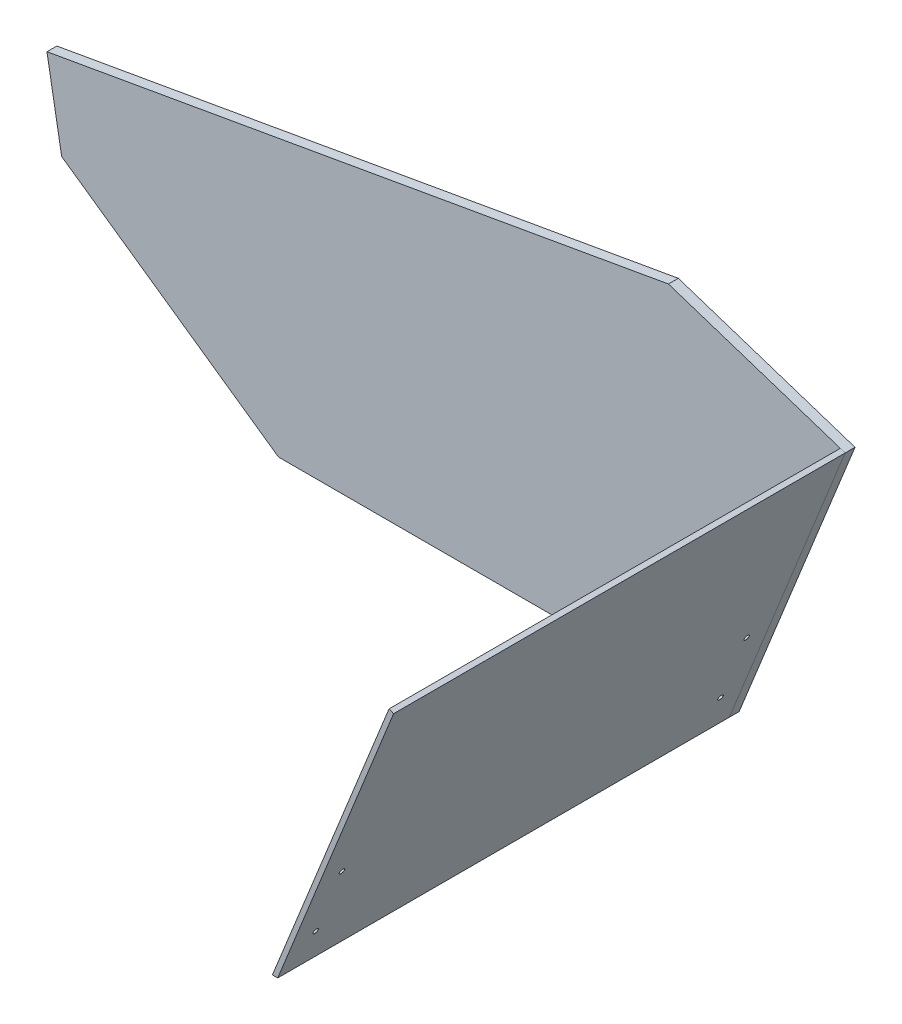
from build123d import *

# Parameters (mm, degrees)
BOSS_EXTRUDE1_DEPTH           = 290
BOSS_EXTRUDE2_DEPTH           = 6.35
M3_CLEARANCE_HOLE1_AT_2_COUNT = 2
M3_CLEARANCE_HOLE1_AT_2_PITCH = 45
M3_CLEARANCE_HOLE1_AT_3_COUNT = 2
M3_CLEARANCE_HOLE1_AT_3_PITCH = 260
M3_CLEARANCE_HOLE1_AT_4_COUNT = 2
M3_CLEARANCE_HOLE1_AT_4_PITCH = 263.865496039


with BuildPart() as part:
    # Sketch1 → Boss-Extrude1 (new body)
    with BuildSketch(Plane.XY):
        Polygon((140, 0), (143.424347808, 0), (217.865127421, 184.247394979), (214.921318683, 185.436770913), align=None)
    extrude(amount=BOSS_EXTRUDE1_DEPTH)

    # Sketch4 → M3 Clearance Hole1 (revolve, cut)
    with BuildSketch(Plane(origin=(169.646809347, 64.90286982, 275), x_dir=(0.3746065934159096, 0.9271838545667884, 0), z_dir=(0, 0, 1))):
        Polygon((0, 0), (0, 489.265093346), (1.7, 489.265093346), (1.7, 0.025), (1.725, 0), align=None)
    m3_clearance_hole1 = revolve(axis=Axis((175.534426824, 62.524117951, 275), (-0.9271838545667884, 0.3746065934159096, 0)), mode=Mode.SUBTRACT)

    # M3 Clearance Hole1 at 2: M3 Clearance Hole1 ×2
    with Locations(*[Vector(-0.3746065934159096, -0.9271838545667884, 0) * (i * M3_CLEARANCE_HOLE1_AT_2_PITCH) for i in range(1, M3_CLEARANCE_HOLE1_AT_2_COUNT)]):
        add(m3_clearance_hole1, mode=Mode.SUBTRACT)

    # M3 Clearance Hole1 at 3: M3 Clearance Hole1 ×2
    with Locations(*[(0, 0, -i * M3_CLEARANCE_HOLE1_AT_3_PITCH) for i in range(1, M3_CLEARANCE_HOLE1_AT_3_COUNT)]):
        add(m3_clearance_hole1, mode=Mode.SUBTRACT)

    # M3 Clearance Hole1 at 4: M3 Clearance Hole1 ×2
    with Locations(*[Vector(-0.06388594551675915, -0.15812326386660155, -0.9853505058554559) * (i * M3_CLEARANCE_HOLE1_AT_4_PITCH) for i in range(1, M3_CLEARANCE_HOLE1_AT_4_COUNT)]):
        add(m3_clearance_hole1, mode=Mode.SUBTRACT)


with BuildPart() as body_2:
    # Sketch2 → Boss-Extrude2 (new body)
    with BuildSketch(Plane.XY):
        Polygon((-294.777867348, 151.108031048), (104.369939009, 221.488558599), (217.865127421, 184.247394979), (143.424347808, 0), (-146.070887152, 0), (-285.326734681, 97.50799418), align=None)
    extrude(amount=-BOSS_EXTRUDE2_DEPTH)


solid = Compound([part.part, body_2.part])
